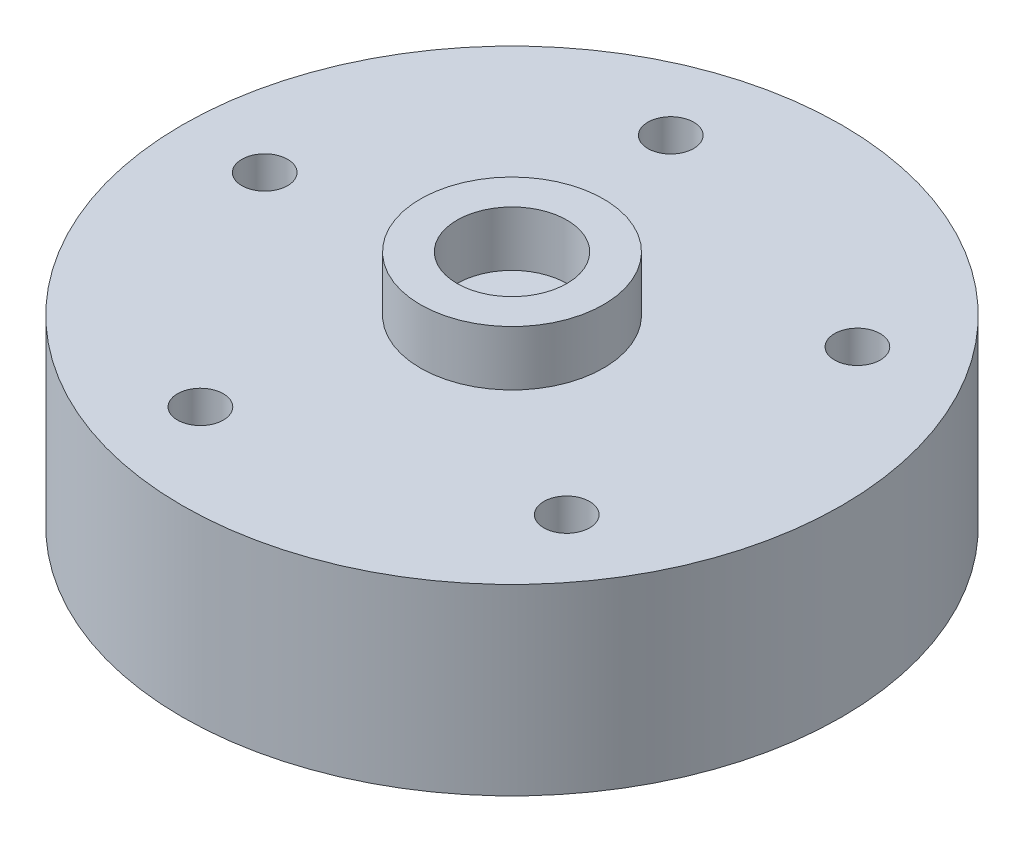
from build123d import *

# Parameters (mm, degrees)
BOSS_EXTRUDE1_DEPTH      = 2
BOSS_EXTRUDE1_DEPTH_BACK = 3
SKETCH1_R                = 16
SKETCH1_R_2              = 1.25
SKETCH2_R                = 5
SKETCH2_R_2              = 3
BOSS_EXTRUDE3_DEPTH      = 3
SKETCH5_R                = 2.75
CUT_EXTRUDE2_DEPTH       = 1
SKETCH6_R                = 16
SKETCH6_R_2              = 11
SKETCH6_R_3              = 1.25
BOSS_EXTRUDE4_DEPTH      = 5
SKETCH7_R                = 18
SKETCH7_R_2              = 16
BOSS_EXTRUDE5_DEPTH      = 10
SKETCH8_R                = 2
CUT_EXTRUDE3_DEPTH       = 3
SKETCH9_R                = 3.75
CUT_EXTRUDE4_DEPTH       = 2


with BuildPart() as part:
    # Sketch1 → Boss-Extrude1 (new, two sides: drawn at the far end of the back side and taken through both)
    with BuildSketch(Plane(origin=(0, 0, 0), x_dir=(1, 0, 0), z_dir=(0, 1, 0)).offset(-BOSS_EXTRUDE1_DEPTH_BACK)):
        Circle(SKETCH1_R)
        with Locations((-13.5, 0)):
            Circle(SKETCH1_R_2, mode=Mode.SUBTRACT)
        with Locations((-4.171729424, 12.83926297)):
            Circle(SKETCH1_R_2, mode=Mode.SUBTRACT)
        with Locations((10.921729424, 7.935100906)):
            Circle(SKETCH1_R_2, mode=Mode.SUBTRACT)
        Circle(SKETCH1_R_2, mode=Mode.SUBTRACT)
        with Locations((-4.171729424, -12.83926297)):
            Circle(SKETCH1_R_2, mode=Mode.SUBTRACT)
        with Locations((10.921729424, -7.935100906)):
            Circle(SKETCH1_R_2, mode=Mode.SUBTRACT)
    extrude(amount=BOSS_EXTRUDE1_DEPTH + BOSS_EXTRUDE1_DEPTH_BACK)

    # Sketch2 → Boss-Extrude3 (add)
    with BuildSketch(Plane(origin=(0, 2, 0), x_dir=(1, 0, 0), z_dir=(0, 1, 0))):
        Circle(SKETCH2_R)
        Circle(SKETCH2_R_2, mode=Mode.SUBTRACT)
    extrude(amount=BOSS_EXTRUDE3_DEPTH)

    # Sketch5 → Cut-Extrude2 (cut)
    with BuildSketch(Plane.XZ.offset(3)):
        Circle(SKETCH5_R)
    extrude(amount=-CUT_EXTRUDE2_DEPTH, mode=Mode.SUBTRACT)

    # Sketch6 → Boss-Extrude4 (add)
    with BuildSketch(Plane.XZ.offset(3)):
        Circle(SKETCH6_R)
        Circle(SKETCH6_R_2, mode=Mode.SUBTRACT)
        with Locations((-13.5, 0)):
            Circle(SKETCH6_R_3, mode=Mode.SUBTRACT)
        with Locations((-4.171729424, 12.83926297)):
            Circle(SKETCH6_R_3, mode=Mode.SUBTRACT)
        with Locations((10.921729424, 7.935100906)):
            Circle(SKETCH6_R_3, mode=Mode.SUBTRACT)
        with Locations((10.921729424, -7.935100906)):
            Circle(SKETCH6_R_3, mode=Mode.SUBTRACT)
        with Locations((-4.171729424, -12.83926297)):
            Circle(SKETCH6_R_3, mode=Mode.SUBTRACT)
    extrude(amount=BOSS_EXTRUDE4_DEPTH)

    # Sketch7 → Boss-Extrude5 (add)
    with BuildSketch(Plane(origin=(0, 2, 0), x_dir=(1, 0, 0), z_dir=(0, 1, 0))):
        Circle(SKETCH7_R)
        Circle(SKETCH7_R_2, mode=Mode.SUBTRACT)
    extrude(amount=-BOSS_EXTRUDE5_DEPTH)

    # Sketch8 → Cut-Extrude3 (cut)
    with BuildSketch(Plane.XZ.offset(2)):
        Circle(SKETCH8_R)
    extrude(amount=-CUT_EXTRUDE3_DEPTH, mode=Mode.SUBTRACT)

    # Sketch9 → Cut-Extrude4 (cut)
    with BuildSketch(Plane.XZ.offset(3)):
        Circle(SKETCH9_R)
    extrude(amount=-CUT_EXTRUDE4_DEPTH, mode=Mode.SUBTRACT)


solid = part.part
